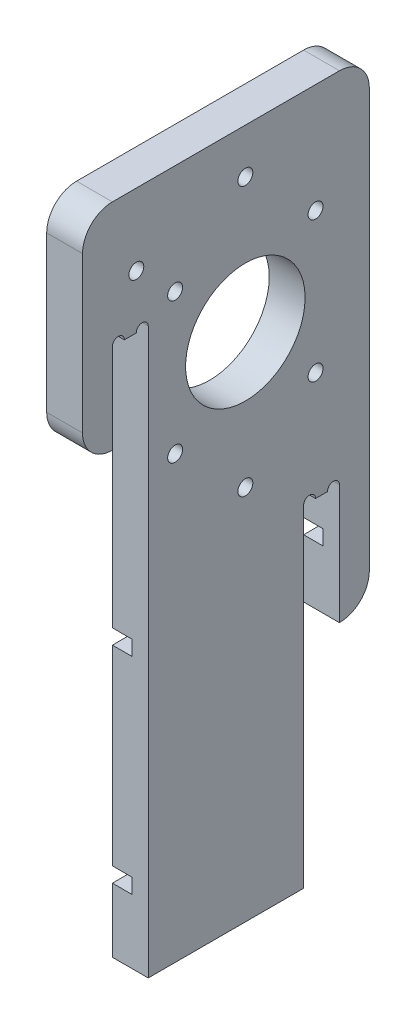
from build123d import *

# Parameters (mm, degrees)
SKETCH1_W                          = 63
SKETCH1_H                          = 120
SKETCH1_R                          = 20
BOSS_EXTRUDE1_DEPTH                = 12
F_5_0_5_DIAMETER_HOLE2_D           = 5
LINEAR_RAIL_MOUNT_HOLE_D           = 5
LINEAR_RAIL_MOUNT_HOLE_CBORE_D     = 12
LINEAR_RAIL_MOUNT_HOLE_CBORE_DEPTH = 6
BOSS_EXTRUDE2_DEPTH                = 12
SKETCH9_W                          = 52
SKETCH9_H                          = 111
BOSS_EXTRUDE3_DEPTH                = 12
SKETCH11_W                         = 10
SKETCH11_H                         = 160
BOSS_EXTRUDE4_DEPTH                = 12
F_5_0_5_DIAMETER_HOLE1_D           = 5
FILLET1_R                          = 10
CUT_EXTRUDE1_REACH                 = 181.876
CUT_EXTRUDE2_DEPTH                 = 8
CUT_EXTRUDE3_DEPTH                 = 6.5
LPATTERN1_COUNT                    = 2
LPATTERN1_PITCH                    = 69
MIRROR1_COPY_1_DEPTH               = 8
MIRROR1_COPY_2_DEPTH               = 6.5


with BuildPart() as part:
    # Sketch1 → Boss-Extrude1 (new body)
    with BuildSketch(Plane(origin=(0, 0, 0), x_dir=(0, 0, -1), z_dir=(1, 0, 0))):
        Rectangle(SKETCH1_W, SKETCH1_H)
        Circle(SKETCH1_R, mode=Mode.SUBTRACT)
    extrude(amount=BOSS_EXTRUDE1_DEPTH)

    # Ø5.0 (5) Diameter Hole2 (through all)
    with Locations(Plane.ZY):
        with Locations((-23.5, 23.5), (23.5, 23.5), (23.5, -23.5), (-23.5, -23.5)):
            Hole(F_5_0_5_DIAMETER_HOLE2_D / 2)

    # Linear Rail Mount Hole (through all)
    with Locations(Plane.ZY):
        with Locations((0, 45), (0, -45)):
            CounterBoreHole(LINEAR_RAIL_MOUNT_HOLE_D / 2, LINEAR_RAIL_MOUNT_HOLE_CBORE_D / 2, LINEAR_RAIL_MOUNT_HOLE_CBORE_DEPTH)

    # Sketch8 → Boss-Extrude2 (add)
    with BuildSketch(Plane.ZY):
        Polygon((44.5, 18), (44.5, -12), (54.5, -12), (54.5, 60), (31.5, 60), (31.5, -60), (32.5, -60), (32.5, 18), align=None)
    extrude(amount=-BOSS_EXTRUDE2_DEPTH)

    # Sketch9 → Boss-Extrude3 (add)
    with BuildSketch(Plane.ZY):
        with Locations((6.5, -115.5)):
            Rectangle(SKETCH9_W, SKETCH9_H)
    extrude(amount=-BOSS_EXTRUDE3_DEPTH)

    # Sketch11 → Boss-Extrude4 (add)
    with BuildSketch(Plane(origin=(12, 0, 0), x_dir=(0, 0, -1), z_dir=(1, 0, 0))):
        with Locations((36.5, -20)):
            Rectangle(SKETCH11_W, SKETCH11_H)
    extrude(amount=-BOSS_EXTRUDE4_DEPTH)

    # Ø5.0 (5) Diameter Hole1 (through all)
    with Locations(Plane(origin=(12, 0, 0), x_dir=(0, 0, -1), z_dir=(1, 0, 0))):
        with Locations((-36.5, 36)):
            Hole(F_5_0_5_DIAMETER_HOLE1_D / 2)

    # Fillet1
    fillet1_edges = [part.edges().sort_by_distance(p)[0] for p in [
        (6, 60, 54.5),
        (6, -12, 54.5),
        (6, -100, -41.5),
        (6, 60, -41.5),
    ]]
    fillet(fillet1_edges, radius=FILLET1_R - 0.0001)  # a hair under: the kernel refuses the full size

    # Sketch25 → Cut-Extrude1 (cut, up to next)
    with BuildSketch(Plane.ZY, mode=Mode.PRIVATE) as cut_extrude1_sk1:
        with BuildLine():
            Line((32.5, 18), (36.5, 18))
            ThreePointArc((36.5, 18), (34.5, 20), (32.5, 18))
        make_face()
    cut_extrude1_tool1 = extrude(cut_extrude1_sk1.sketch, amount=-CUT_EXTRUDE1_REACH, mode=Mode.PRIVATE) & part.part
    # Sketch25 → Cut-Extrude1 (cut, up to next)
    with BuildSketch(Plane.ZY, mode=Mode.PRIVATE) as cut_extrude1_sk2:
        with BuildLine():
            Line((40.5, 18), (44.5, 18))
            ThreePointArc((44.5, 18), (42.5, 20), (40.5, 18))
        make_face()
    cut_extrude1_tool2 = extrude(cut_extrude1_sk2.sketch, amount=-CUT_EXTRUDE1_REACH, mode=Mode.PRIVATE) & part.part
    # Sketch25 → Cut-Extrude1 (cut, up to next)
    with BuildSketch(Plane.ZY, mode=Mode.PRIVATE) as cut_extrude1_sk3:
        with BuildLine():
            Line((-31.5, -60), (-27.5, -60))
            ThreePointArc((-27.5, -60), (-29.5, -58), (-31.5, -60))
        make_face()
    cut_extrude1_tool3 = extrude(cut_extrude1_sk3.sketch, amount=-CUT_EXTRUDE1_REACH, mode=Mode.PRIVATE) & part.part
    # Sketch25 → Cut-Extrude1 (cut, up to next)
    with BuildSketch(Plane.ZY, mode=Mode.PRIVATE) as cut_extrude1_sk4:
        with BuildLine():
            Line((-23.5, -60), (-19.5, -60))
            ThreePointArc((-19.5, -60), (-21.5, -58), (-23.5, -60))
        make_face()
    cut_extrude1_tool4 = extrude(cut_extrude1_sk4.sketch, amount=-CUT_EXTRUDE1_REACH, mode=Mode.PRIVATE) & part.part
    add(cut_extrude1_tool1.solids().sort_by_distance((0, 18.848826, 34.5))[0], mode=Mode.SUBTRACT)
    add(cut_extrude1_tool2.solids().sort_by_distance((0, 18.848826, 42.5))[0], mode=Mode.SUBTRACT)
    add(cut_extrude1_tool3.solids().sort_by_distance((0, -59.151174, -29.5))[0], mode=Mode.SUBTRACT)
    add(cut_extrude1_tool4.solids().sort_by_distance((0, -59.151174, -21.5))[0], mode=Mode.SUBTRACT)

    # Sketch27 → Cut-Extrude2 (cut)
    with BuildSketch(Plane(origin=(0, 35.243272034, 16.659279863), x_dir=(0, 0, 1), z_dir=(-1, 0, 0))):
        with BuildLine():
            Line((5.840720137, -178.243272034), (5.840720137, -186.243272034))
            ThreePointArc((5.840720137, -186.243272034), (3.840720137, -188.243272034), (1.840720137, -186.243272034))
            Line((1.840720137, -186.243272034), (1.840720137, -178.243272034))
            ThreePointArc((1.840720137, -178.243272034), (3.840720137, -176.243272034), (5.840720137, -178.243272034))
        make_face()
    cut_extrude2 = extrude(amount=-CUT_EXTRUDE2_DEPTH, mode=Mode.SUBTRACT)

    # Sketch29 → Cut-Extrude3 (cut)
    with BuildSketch(Plane(origin=(0, 35.243272034, 16.659279863), x_dir=(0, 0, 1), z_dir=(-1, 0, 0))):
        with BuildLine():
            Line((61.738206335, -184.743272034), (-1.159279863, -184.743272034))
            ThreePointArc((-1.159279863, -184.743272034), (-3.659279863, -182.243272034), (-1.159279863, -179.743272034))
            Line((-1.159279863, -179.743272034), (61.738206335, -179.743272034))
            ThreePointArc((61.738206335, -179.743272034), (64.238206335, -182.243272034), (61.738206335, -184.743272034))
        make_face()
    cut_extrude3 = extrude(amount=-CUT_EXTRUDE3_DEPTH, mode=Mode.SUBTRACT)

    # LPattern1: Cut-Extrude2, Cut-Extrude3 ×2
    with Locations(*[(0, i * LPATTERN1_PITCH, 0) for i in range(1, LPATTERN1_COUNT)]):
        add(cut_extrude2, mode=Mode.SUBTRACT)
        add(cut_extrude3, mode=Mode.SUBTRACT)

    # Mirror1: Cut-Extrude2, Cut-Extrude3 across plane
    add(cut_extrude2.mirror(Plane.XY.offset(6.5)), mode=Mode.SUBTRACT)
    add(cut_extrude3.mirror(Plane.XY.offset(6.5)), mode=Mode.SUBTRACT)

    # Mirror1 copy 1 sketch → Mirror1 copy 1 (cut)
    with BuildSketch(Plane(origin=(0, 104.243272034, -3.659279863), x_dir=(0, 0, -1), z_dir=(-1, 0, 0))):
        with BuildLine():
            Line((5.840720137, 178.243272034), (5.840720137, 186.243272034))
            ThreePointArc((5.840720137, 186.243272034), (3.840720137, 188.243272034), (1.840720137, 186.243272034))
            Line((1.840720137, 186.243272034), (1.840720137, 178.243272034))
            ThreePointArc((1.840720137, 178.243272034), (3.840720137, 176.243272034), (5.840720137, 178.243272034))
        make_face()
    extrude(amount=-MIRROR1_COPY_1_DEPTH, mode=Mode.SUBTRACT)

    # Mirror1 copy 2 sketch → Mirror1 copy 2 (cut)
    with BuildSketch(Plane(origin=(0, 104.243272034, -3.659279863), x_dir=(0, 0, -1), z_dir=(-1, 0, 0))):
        with BuildLine():
            Line((61.738206335, 184.743272034), (-1.159279863, 184.743272034))
            ThreePointArc((-1.159279863, 184.743272034), (-3.659279863, 182.243272034), (-1.159279863, 179.743272034))
            Line((-1.159279863, 179.743272034), (61.738206335, 179.743272034))
            ThreePointArc((61.738206335, 179.743272034), (64.238206335, 182.243272034), (61.738206335, 184.743272034))
        make_face()
    extrude(amount=-MIRROR1_COPY_2_DEPTH, mode=Mode.SUBTRACT)


solid = part.part
